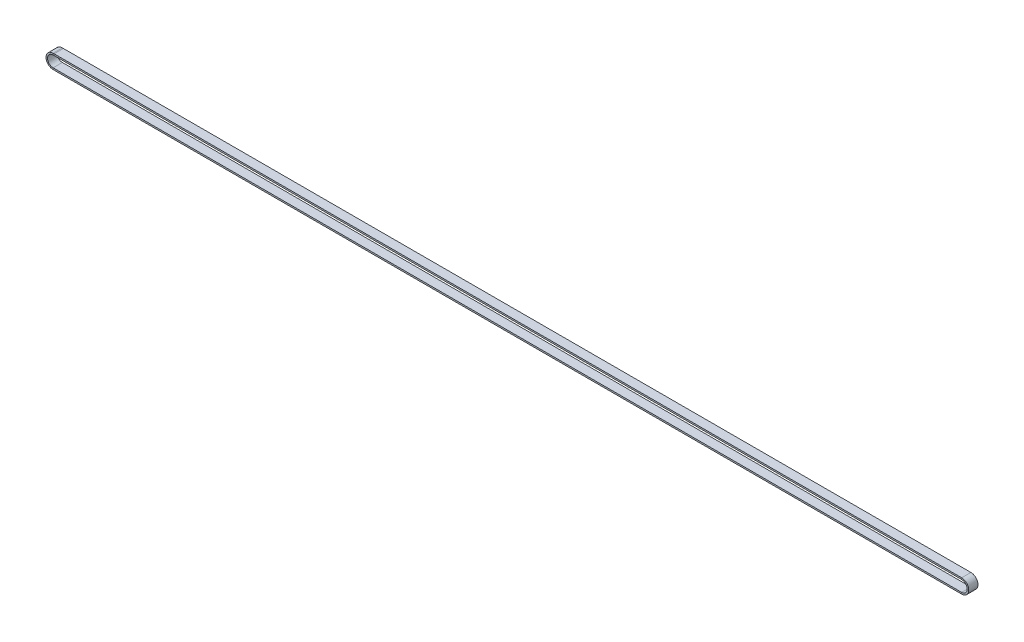
from build123d import *

# Parameters (mm, degrees)
SKETCH3_W = 9
SKETCH3_H = 1.5


with BuildPart() as part:
    # Sweep1: sweep along a path in Sketch2
    with BuildLine(Plane.XY) as sweep1_path:
        Line((-1, -32.11575562), (883.52063792, -32.11575562))
        ThreePointArc((883.52063792, -32.11575562), (890.42063792, -39.01575562), (883.52063792, -45.91575562))
        Line((883.52063792, -45.91575562), (-1, -45.91575562))
        ThreePointArc((-1, -45.91575562), (-7.9, -39.01575562), (-1, -32.11575562))
    # Sketch3 → Sweep1 (sweep)
    with BuildSketch(Plane(origin=(0, 0, 0), x_dir=(0, 0, -1), z_dir=(1, 0, 0))):
        with Locations((-4.5, -32.86575562)):
            Rectangle(SKETCH3_W, SKETCH3_H)
    sweep(path=sweep1_path.line)


solid = part.part
